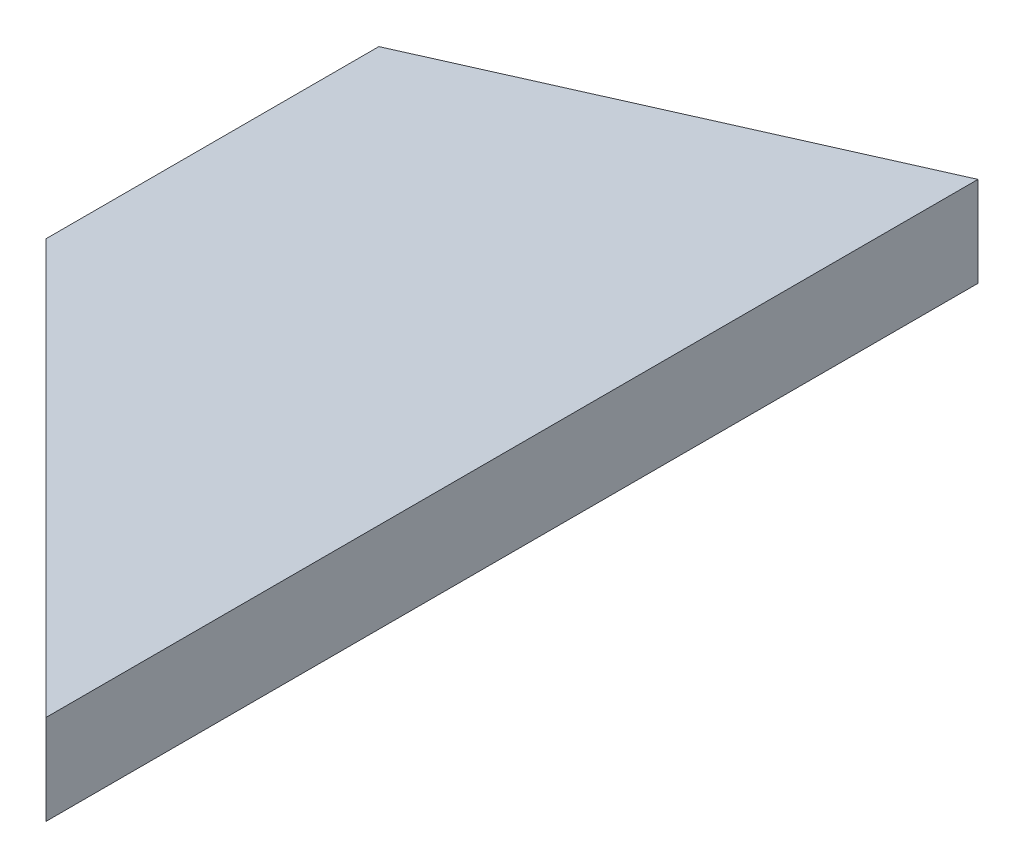
from build123d import *

# Parameters (mm, degrees)
BOSS_EXTRUDE1_DEPTH = 88.9
CHAMFER1_SIZE       = 28.575


with BuildPart() as part:
    # Sketch1 → Boss-Extrude1 (new body)
    with BuildSketch(Plane.XY):
        Polygon((0, 0), (0, 19.558), (28.575, 8.589085199), (28.575, 0), align=None)
    extrude(amount=BOSS_EXTRUDE1_DEPTH)

    # Chamfer1
    chamfer1_edges = [part.edges().sort_by_distance(p)[0] for p in [
        (0, 9.779, 88.9),
        (0, 9.779, 0),
    ]]
    chamfer(chamfer1_edges, length=CHAMFER1_SIZE - 0.0001)  # a hair under: the kernel refuses the full size


solid = part.part
